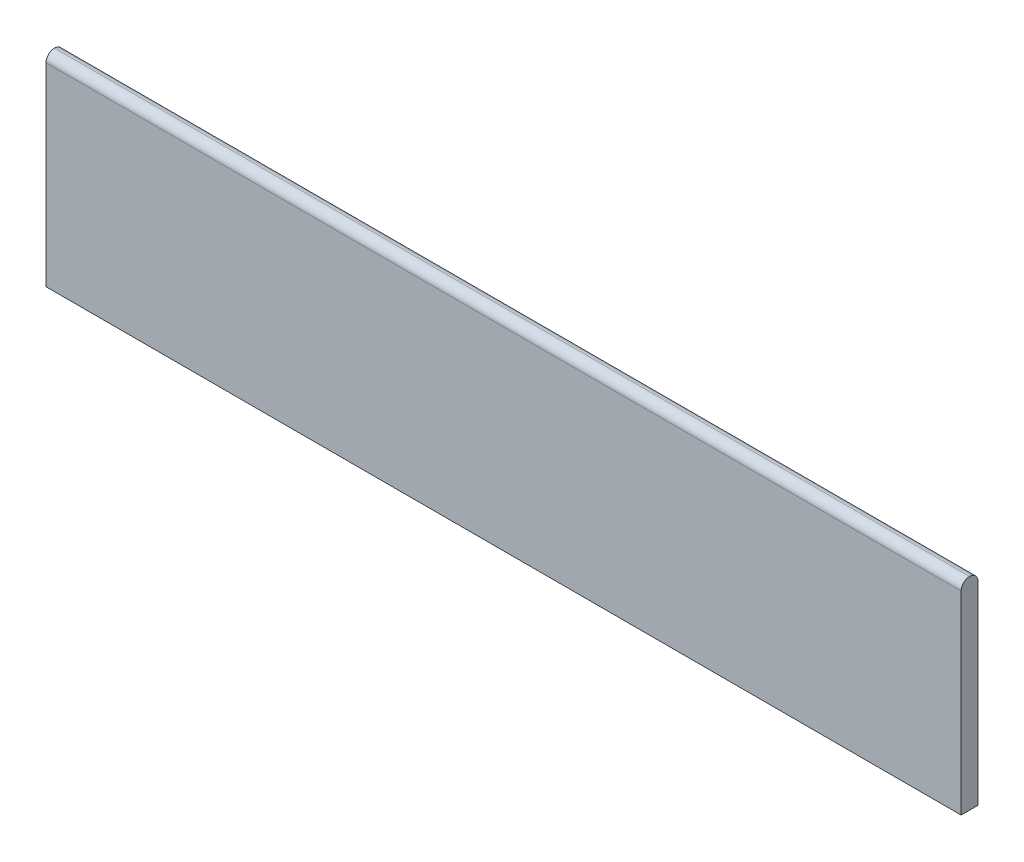
from build123d import *

# Parameters (mm, degrees)
SKETCH_1_W      = 678
SKETCH_1_H      = 150
EXTRUDE_1_DEPTH = 12.5
FILLET_1_R      = 6.25
FILLET_2_R      = 6.25


with BuildPart() as part:
    # 草图1 → 凸台-拉伸1 (new body)
    with BuildSketch(Plane.XY):
        with Locations((339, 75)):
            Rectangle(SKETCH_1_W, SKETCH_1_H)
    extrude(amount=EXTRUDE_1_DEPTH)

    # 圆角1
    fillet_1_edges = [part.edges().sort_by_distance(p)[0] for p in [
        (339, 150, 12.5),
    ]]
    fillet(fillet_1_edges, radius=FILLET_1_R)

    # 圆角2
    fillet_2_edges = [part.edges().sort_by_distance(p)[0] for p in [
        (339, 150, 0),
    ]]
    fillet(fillet_2_edges, radius=FILLET_2_R - 0.0001)  # a hair under: the kernel refuses the full size


solid = part.part
